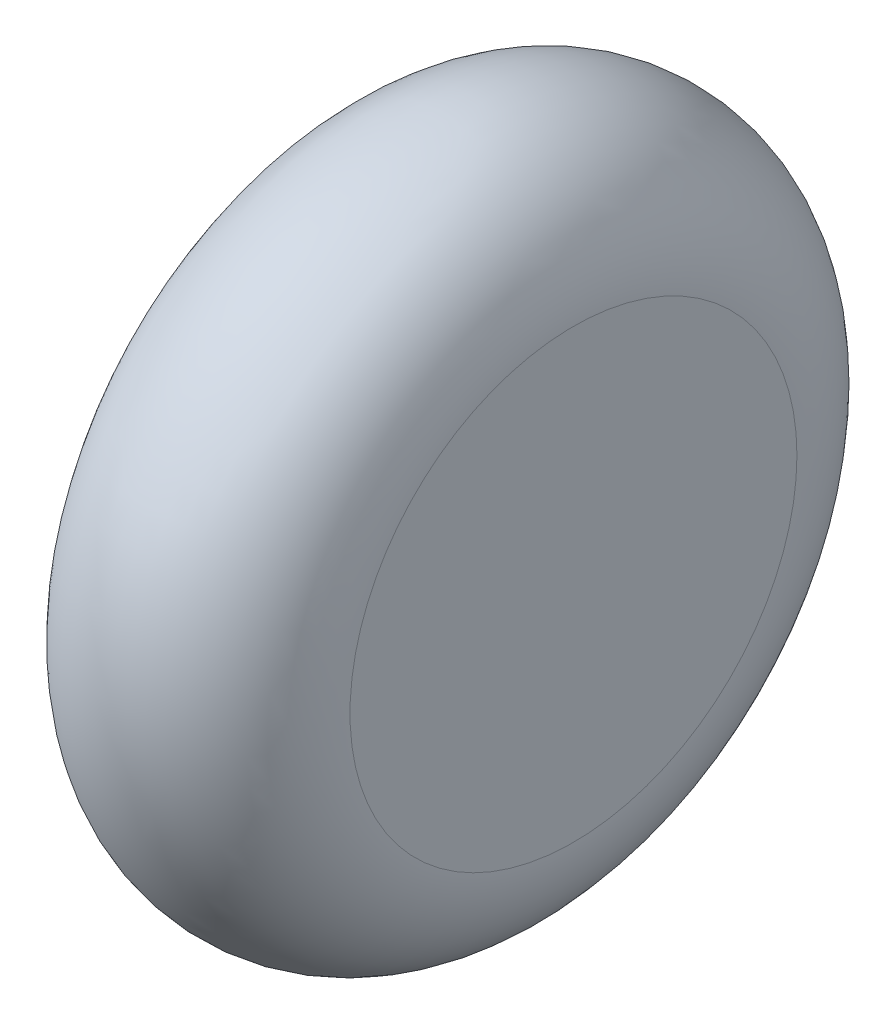
from build123d import *

# Parameters (mm, degrees)
SKETCH1_R           = 12.7
BOSS_EXTRUDE1_DEPTH = 4.572
FILLET1_R           = 4.572


with BuildPart() as part:
    # Sketch1 → Boss-Extrude1 (new, symmetric)
    with BuildSketch(Plane(origin=(0, 0, 0), x_dir=(0, 0, -1), z_dir=(1, 0, 0))):
        Circle(SKETCH1_R)
    extrude(amount=BOSS_EXTRUDE1_DEPTH, both=True)

    # Fillet1
    fillet1_edges = [part.edges().sort_by_distance(p)[0] for p in [
        (-4.572, 0, 12.7),
        (4.572, 0, 12.7),
    ]]
    fillet(fillet1_edges, radius=FILLET1_R - 0.0001)  # a hair under: the kernel refuses the full size


solid = part.part
